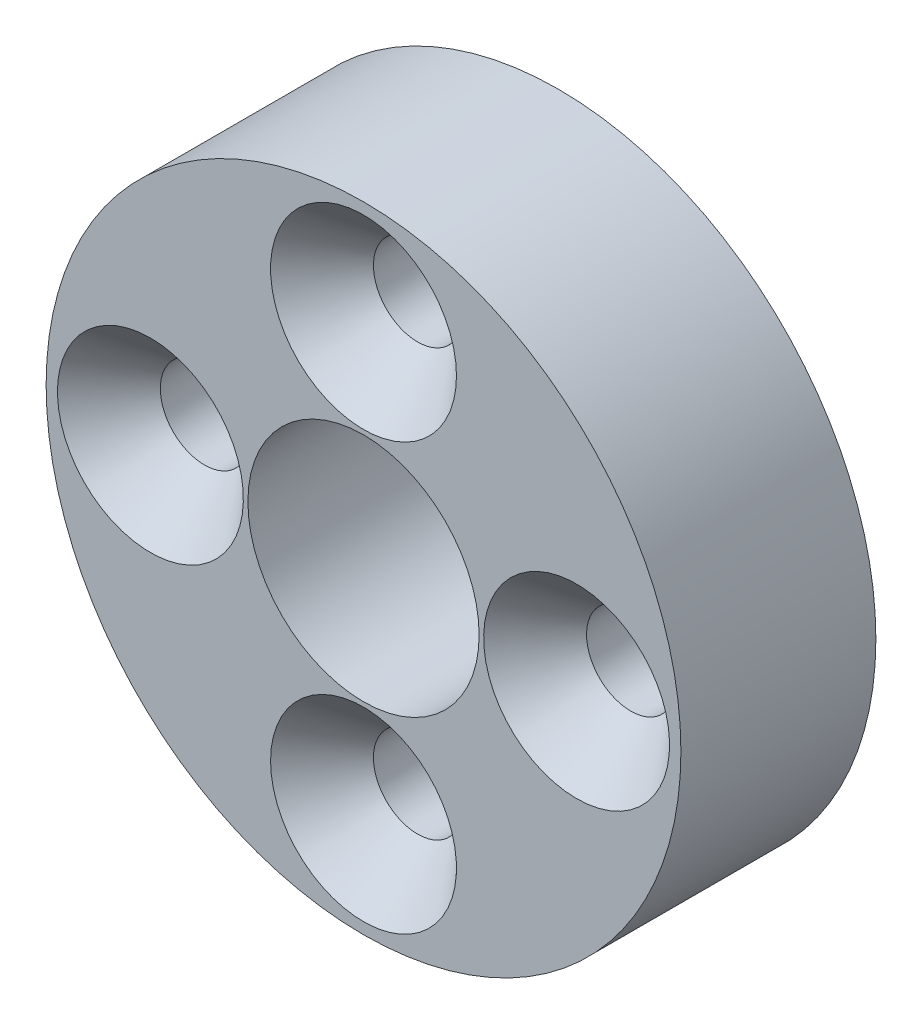
from build123d import *
from build123d.topology import SkipClean

# Parameters (mm, degrees)
SKETCH1_R           = 17.78
SKETCH1_R_2         = 2.4765
SKETCH1_R_3         = 6.477
BOSS_EXTRUDE1_DEPTH = 10.922
BOSS_EXTRUDE2_START = 3.175
SKETCH2_W           = 16.51
SKETCH2_H           = 16.51
SKETCH2_R           = 6.477
BOSS_EXTRUDE2_DEPTH = 3.175
CIRPATTERN4_COUNT   = 4


with BuildPart() as part:
    # Sketch1 → Boss-Extrude1 (new body)
    with BuildSketch(Plane.XY):
        Circle(SKETCH1_R)
        with Locations((-11.938, 0)):
            Circle(SKETCH1_R_2, mode=Mode.SUBTRACT)
        with Locations((0, -11.938)):
            Circle(SKETCH1_R_2, mode=Mode.SUBTRACT)
        with Locations((11.938, 0)):
            Circle(SKETCH1_R_2, mode=Mode.SUBTRACT)
        with Locations((0, 11.938)):
            Circle(SKETCH1_R_2, mode=Mode.SUBTRACT)
        Circle(SKETCH1_R_3, mode=Mode.SUBTRACT)
    extrude(amount=BOSS_EXTRUDE1_DEPTH)

    # Sketch2 → Boss-Extrude2 (add)
    with SkipClean():  # the faces are left unmerged after this step: merging them gives an invalid solid
        with BuildSketch(Plane(origin=(0, 0, 0), x_dir=(-1, 0, 0), z_dir=(0, 0, -1)).offset(BOSS_EXTRUDE2_START)):
            Rectangle(SKETCH2_W, SKETCH2_H)
            Circle(SKETCH2_R, mode=Mode.SUBTRACT)
        extrude(amount=-BOSS_EXTRUDE2_DEPTH)

    # Sketch5 → Cut-Revolve1 (revolve, cut)
    with SkipClean():  # the faces are left unmerged after this step: merging them gives an invalid solid
        with BuildSketch(Plane(origin=(0, 0, 0), x_dir=(0, 0, -1), z_dir=(1, 0, 0))):
            Polygon((-10.922, 11.938), (-10.922, 17.145), (-7.62, 14.171865846), (-7.62, 11.938), align=None)
        cut_revolve1 = revolve(axis=Axis((0, 11.938, 10.922), (0, 0, -1)), mode=Mode.SUBTRACT)

    # CirPattern4: Cut-Revolve1 ×4 about axis
    with SkipClean():  # the faces are left unmerged after this step: merging them gives an invalid solid
        cirpattern4_axis = Axis((0, 0, 10.922), (0, 0, 1))
        for i in range(1, CIRPATTERN4_COUNT):
            add(cut_revolve1.rotate(cirpattern4_axis, i * 360 / CIRPATTERN4_COUNT), mode=Mode.SUBTRACT)


solid = part.part
